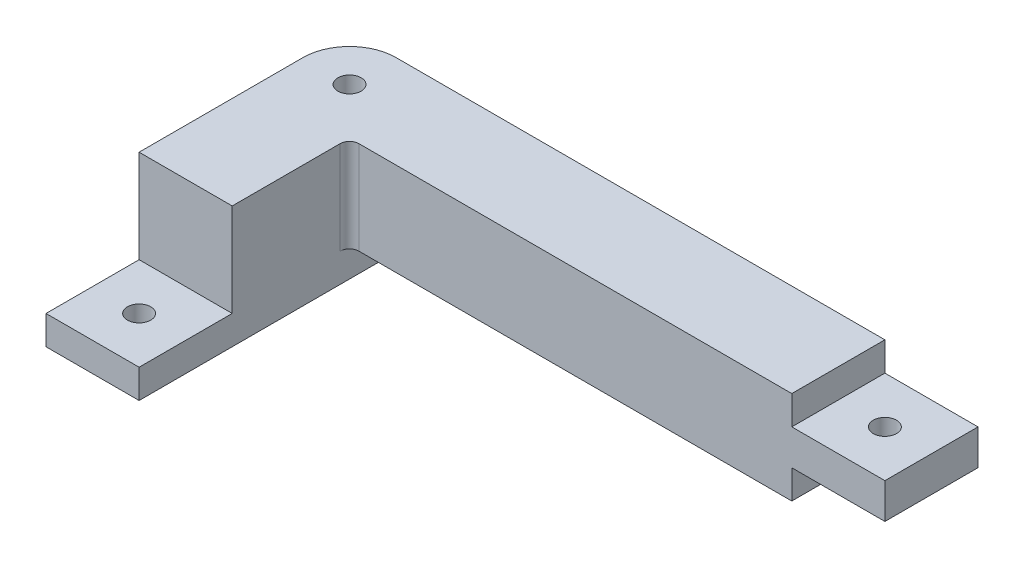
from build123d import *

# Parameters (mm, degrees)
SKETCH1_W           = 25.4
SKETCH1_H           = 82.804
BOSS_EXTRUDE1_DEPTH = 33.274
SKETCH3_W           = 25.4
SKETCH3_H           = 25.4
BOSS_EXTRUDE2_DEPTH = 120.65
SKETCH4_W           = 25.4
SKETCH4_H           = 25.4
CUT_EXTRUDE2_DEPTH  = 25.4
SKETCH5_W           = 25.4
SKETCH5_H           = 9.652
BOSS_EXTRUDE3_DEPTH = 25.4
SKETCH7_R           = 3.175
CUT_EXTRUDE4_DEPTH  = 41.402
SKETCH8_R           = 3.175
CUT_EXTRUDE5_DEPTH  = 25.4
SKETCH6_R           = 3.175
CUT_EXTRUDE3_DEPTH  = 41.402
FILLET1_R           = 12.7
FILLET2_R           = 2.54


with BuildPart() as part:
    # Sketch1 → Boss-Extrude1 (new body)
    with BuildSketch(Plane(origin=(0, 0, 0), x_dir=(1, 0, 0), z_dir=(0, 1, 0))):
        with Locations((13.650196891, -15.542365285)):
            Rectangle(SKETCH1_W, SKETCH1_H)
    extrude(amount=BOSS_EXTRUDE1_DEPTH)

    # Sketch3 → Boss-Extrude2 (add)
    with BuildSketch(Plane(origin=(26.350196891, 0, 0), x_dir=(0, 0, -1), z_dir=(1, 0, 0))):
        with Locations((13.159634715, 20.574)):
            Rectangle(SKETCH3_W, SKETCH3_H)
    extrude(amount=BOSS_EXTRUDE2_DEPTH)

    # Sketch4 → Cut-Extrude2 (cut)
    with BuildSketch(Plane.XY.offset(56.944365285)):
        with Locations((13.650196891, 20.574)):
            Rectangle(SKETCH4_W, SKETCH4_H)
    extrude(amount=-CUT_EXTRUDE2_DEPTH, mode=Mode.SUBTRACT)

    # Sketch5 → Boss-Extrude3 (add)
    with BuildSketch(Plane(origin=(147.000196891, 0, 0), x_dir=(0, 0, -1), z_dir=(1, 0, 0))):
        with Locations((13.159634715, 20.574)):
            Rectangle(SKETCH5_W, SKETCH5_H)
    extrude(amount=BOSS_EXTRUDE3_DEPTH)

    # Sketch7 → Cut-Extrude4 (cut)
    with BuildSketch(Plane(origin=(0, 25.4, 0), x_dir=(1, 0, 0), z_dir=(0, 1, 0))):
        with Locations((159.700196891, 13.159634715)):
            Circle(SKETCH7_R)
    extrude(amount=-CUT_EXTRUDE4_DEPTH, mode=Mode.SUBTRACT)

    # Sketch8 → Cut-Extrude5 (cut)
    with BuildSketch(Plane(origin=(0, 7.874, 0), x_dir=(1, 0, 0), z_dir=(0, 1, 0))):
        with Locations((13.650196891, -44.244365285)):
            Circle(SKETCH8_R)
    extrude(amount=-CUT_EXTRUDE5_DEPTH, mode=Mode.SUBTRACT)

    # Sketch6 → Cut-Extrude3 (cut)
    with BuildSketch(Plane(origin=(0, 33.274, 0), x_dir=(1, 0, 0), z_dir=(0, 1, 0))):
        with Locations((13.650196891, 13.159634715)):
            Circle(SKETCH6_R)
    extrude(amount=-CUT_EXTRUDE3_DEPTH, mode=Mode.SUBTRACT)

    # Fillet1
    fillet1_edges = [part.edges().sort_by_distance(p)[0] for p in [
        (0.950196891, 16.637, -25.859634715),
    ]]
    fillet(fillet1_edges, radius=FILLET1_R)

    # Fillet2
    fillet2_edges = [part.edges().sort_by_distance(p)[0] for p in [
        (26.350196891, 20.574, -0.459634715),
    ]]
    fillet(fillet2_edges, radius=FILLET2_R)


solid = part.part
